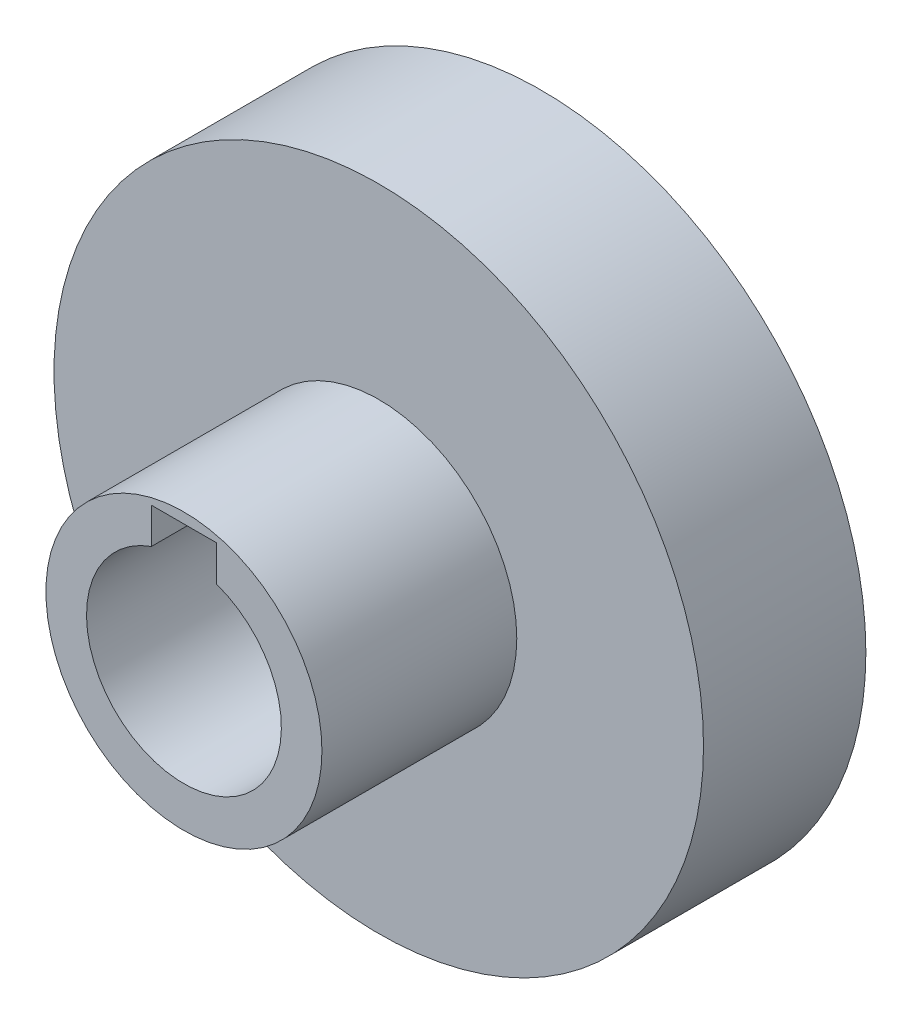
from build123d import *

# Parameters (mm, degrees)
SKETCH1_R           = 10
BOSS_EXTRUDE1_DEPTH = 5
SKETCH3_R           = 4.25
BOSS_EXTRUDE2_DEPTH = 6
CUT_EXTRUDE1_DEPTH  = 6


# Read off the part's stored shape, not the designer's step: Split1
with BuildPart() as part:
    # Sketch1 → Boss-Extrude1 (new body)
    with BuildSketch(Plane(origin=(0, 0, 0), x_dir=(0, 1, 0), z_dir=(0, 0, 1))):
        with Locations(Location((0, 0, 0), (0, 0, 270))):
            Circle(SKETCH1_R)
    extrude(amount=BOSS_EXTRUDE1_DEPTH)

    # Sketch3 → Boss-Extrude2 (add)
    with BuildSketch(Plane.XY.offset(5)):
        Circle(SKETCH3_R)
    extrude(amount=BOSS_EXTRUDE2_DEPTH)

    # Sketch2 → Cut-Extrude1 (cut)
    with BuildSketch(Plane.XY.offset(11)):
        with BuildLine():
            Line((-1, 3.928427125), (1, 3.928427125))
            Line((1, 3.928427125), (1, 2.828427125))
            ThreePointArc((1, 2.828427125), (0, -3), (-1, 2.828427125))
            Line((-1, 2.828427125), (-1, 3.928427125))
        make_face()
    extrude(amount=-CUT_EXTRUDE1_DEPTH, mode=Mode.SUBTRACT)


with BuildPart() as body_2:
    # Split1: the piece on the far side of the plane
    add(part.part)
    split(bisect_by=Plane.XY.offset(5), keep=Keep.BOTTOM)


with BuildPart() as part_1:
    add(part.part)

    # Split1
    split(bisect_by=Plane.XY.offset(5), keep=Keep.TOP)


solid = Compound([body_2.part, part_1.part])
